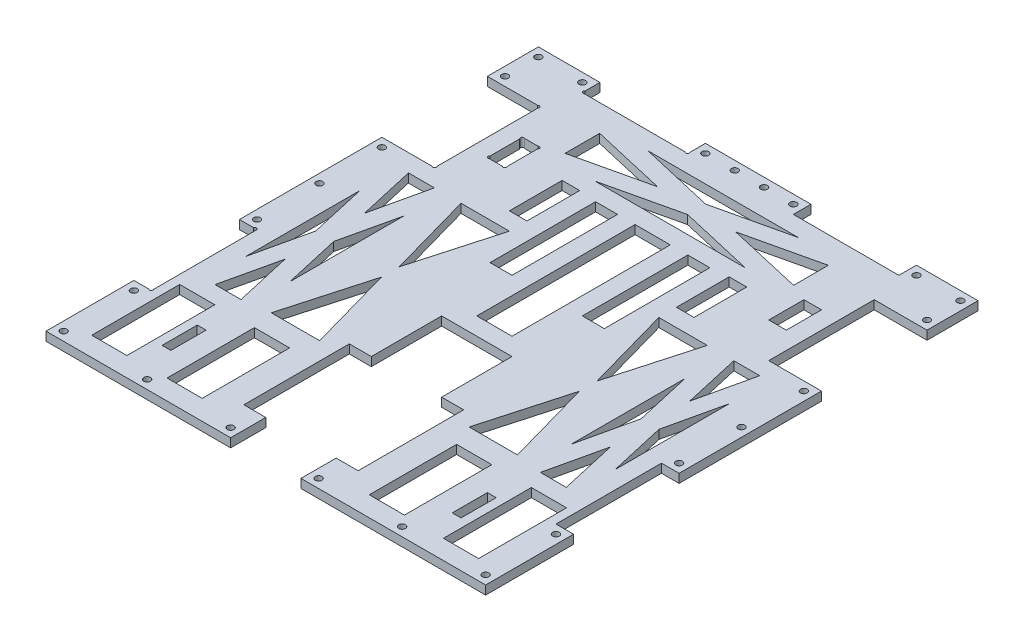
from build123d import *

# Parameters (mm, degrees)
SKETCH1_W           = 317.5
SKETCH1_H           = 355.6
BOSS_EXTRUDE1_DEPTH = 6.35
SKETCH2_W           = 50.8
SKETCH2_H           = 152.4
CUT_EXTRUDE1_DEPTH  = 239.442288615
SKETCH3_W           = 25.4
SKETCH3_H           = 76.2
SKETCH3_W_2         = 12.7
SKETCH3_H_2         = 25.4
CUT_EXTRUDE2_DEPTH  = 239.442288615
SKETCH4_W           = 12.7
SKETCH4_H           = 76.2
SKETCH4_W_2         = 76.2
SKETCH4_H_2         = 12.7
SKETCH4_W_3         = 15.875
CUT_EXTRUDE3_DEPTH  = 239.442288615
SKETCH5_W           = 25.4
SKETCH5_H           = 63.089423232
SKETCH5_H_2         = 114.3
SKETCH5_W_2         = 12.7
SKETCH5_H_3         = 38.1
SKETCH5_H_4         = 63.5
SKETCH5_W_3         = 6.35
SKETCH5_H_5         = 25.4
CUT_EXTRUDE4_DEPTH  = 239.442288615
SKETCH7_R           = 2.413
CUT_EXTRUDE6_DEPTH  = 239.442288615
SKETCH8_R           = 1.27
CUT_EXTRUDE7_DEPTH  = 239.442288615


with BuildPart() as part:
    # Sketch1 → Boss-Extrude1 (new body)
    with BuildSketch(Plane(origin=(0, 0, 0), x_dir=(1, 0, 0), z_dir=(0, 1, 0))):
        Rectangle(SKETCH1_W, SKETCH1_H)
    extrude(amount=BOSS_EXTRUDE1_DEPTH)

    # Sketch2 → Cut-Extrude1 (cut, through all)
    with BuildSketch(Plane(origin=(0, 6.35, 0), x_dir=(1, 0, 0), z_dir=(0, 1, 0))):
        with Locations((0, -101.6)):
            Rectangle(SKETCH2_W, SKETCH2_H)
    extrude(amount=-CUT_EXTRUDE1_DEPTH, mode=Mode.SUBTRACT)

    # Sketch3 → Cut-Extrude2 (cut, through all)
    with BuildSketch(Plane(origin=(0, 6.35, 0), x_dir=(1, 0, 0), z_dir=(0, 1, 0))):
        with Locations((133.35, 102.87)):
            Rectangle(SKETCH3_W, SKETCH3_H)
        with Locations((101.6, 102.87)):
            Rectangle(SKETCH3_W_2, SKETCH3_H_2)
        with Locations((-101.6, 102.87)):
            Rectangle(SKETCH3_W_2, SKETCH3_H_2)
        with Locations((-133.35, 102.87)):
            Rectangle(SKETCH3_W, SKETCH3_H)
    extrude(amount=-CUT_EXTRUDE2_DEPTH, mode=Mode.SUBTRACT)

    # Sketch4 → Cut-Extrude3 (cut, through all)
    with BuildSketch(Plane(origin=(0, 6.35, 0), x_dir=(1, 0, 0), z_dir=(0, 1, 0))):
        with Locations((-152.4, 102.87)):
            Rectangle(SKETCH4_W, SKETCH4_H)
        with Locations((-152.4, -76.2)):
            Rectangle(SKETCH4_W, SKETCH4_H)
        with Locations((152.4, 102.87)):
            Rectangle(SKETCH4_W, SKETCH4_H)
        with Locations((152.4, -76.2)):
            Rectangle(SKETCH4_W, SKETCH4_H)
        with Locations((76.2, 171.45)):
            Rectangle(SKETCH4_W_2, SKETCH4_H_2)
        with Locations((-76.2, 171.45)):
            Rectangle(SKETCH4_W_2, SKETCH4_H_2)
        with Locations((-33.3375, -114.3)):
            Rectangle(SKETCH4_W_3, SKETCH4_H)
        with Locations((33.3375, 63.5)):
            Rectangle(SKETCH4_W_3, SKETCH4_H)
        with Locations((-33.3375, 63.5)):
            Rectangle(SKETCH4_W_3, SKETCH4_H)
        with Locations((33.3375, -114.3)):
            Rectangle(SKETCH4_W_3, SKETCH4_H)
    extrude(amount=-CUT_EXTRUDE3_DEPTH, mode=Mode.SUBTRACT)

    # Sketch5 → Cut-Extrude4 (cut, through all)
    with BuildSketch(Plane(origin=(0, 6.35, 0), x_dir=(1, 0, 0), z_dir=(0, 1, 0))):
        with Locations((-73.025, -131.874711616)):
            Rectangle(SKETCH5_W, SKETCH5_H)
        Polygon((-117.475, -46.432505999), (-126.838066818, -87.63), (-108.111933182, -87.63), align=None)
        Polygon((-133.35, 23.417494001), (-133.35, -58.977494001), (-123.986933182, -17.78), align=None)
        Polygon((-101.6, 23.417494001), (-110.963066818, -17.78), (-101.6, -58.977494001), align=None)
        Polygon((-126.838066818, 52.07), (-117.475, 10.872505999), (-108.111933182, 52.07), align=None)
        Polygon((0, 126.833110246), (-54.310144398, 114.3), (54.310144398, 114.3), align=None)
        Polygon((-82.55, 145.883110246), (-82.55, 120.816889754), (-28.239855602, 133.35), align=None)
        Polygon((82.55, 145.883110246), (28.239855602, 133.35), (82.55, 120.816889754), align=None)
        Polygon((-54.310144398, 152.4), (0, 139.866889754), (54.310144398, 152.4), align=None)
        with Locations((0, 44.45)):
            Rectangle(SKETCH5_W, SKETCH5_H_2)
        with Locations((-60.325, 83.82)):
            Rectangle(SKETCH5_W_2, SKETCH5_H_3)
        with Locations((60.325, 83.82)):
            Rectangle(SKETCH5_W_2, SKETCH5_H_3)
        with Locations((-127, -132.08)):
            Rectangle(SKETCH5_W, SKETCH5_H_4)
        Polygon((-71.4375, -22.791352996), (-88.9, -84.952705992), (-53.975, -84.952705992), align=None)
        with Locations((-104.775, -132.08)):
            Rectangle(SKETCH5_W_3, SKETCH5_H_5)
        Polygon((-53.975, 52.07), (-88.9, 52.07), (-71.4375, -10.091352996), align=None)
    cut_extrude4 = extrude(amount=-CUT_EXTRUDE4_DEPTH, mode=Mode.SUBTRACT)

    # Mirror1: Cut-Extrude4 across plane
    add(cut_extrude4.mirror(Plane(origin=(0, 0, 0), x_dir=(0, 0, 1), z_dir=(1, 0, 0))), mode=Mode.SUBTRACT)

    # Sketch7 → Cut-Extrude6 (cut, through all)
    with BuildSketch(Plane(origin=(0, 6.35, 0), x_dir=(1, 0, 0), z_dir=(0, 1, 0))):
        with Locations((-152.4, -171.45)):
            Circle(SKETCH7_R)
        with Locations((-152.4, 171.45)):
            Circle(SKETCH7_R)
        with Locations((-120.65, 171.45)):
            Circle(SKETCH7_R)
        with Locations((-152.4, 147.32)):
            Circle(SKETCH7_R)
        with Locations((-31.75, 171.45)):
            Circle(SKETCH7_R)
        with Locations((-10.583333333, 171.45)):
            Circle(SKETCH7_R)
        with Locations((10.583333333, 171.45)):
            Circle(SKETCH7_R)
        with Locations((31.75, 171.45)):
            Circle(SKETCH7_R)
        with Locations((-31.75, -171.45)):
            Circle(SKETCH7_R)
        with Locations((-92.075, -171.45)):
            Circle(SKETCH7_R)
        with Locations((-152.4, -120.65)):
            Circle(SKETCH7_R)
        with Locations((-152.4, -31.75)):
            Circle(SKETCH7_R)
        with Locations((-152.4, 58.42)):
            Circle(SKETCH7_R)
        with Locations((-152.4, 13.335)):
            Circle(SKETCH7_R)
        with Locations((31.75, -171.45)):
            Circle(SKETCH7_R)
        with Locations((152.4, 13.335)):
            Circle(SKETCH7_R)
        with Locations((152.4, 58.42)):
            Circle(SKETCH7_R)
        with Locations((152.4, -31.75)):
            Circle(SKETCH7_R)
        with Locations((152.4, -120.65)):
            Circle(SKETCH7_R)
        with Locations((92.075, -171.45)):
            Circle(SKETCH7_R)
        with Locations((152.4, 147.32)):
            Circle(SKETCH7_R)
        with Locations((120.65, 171.45)):
            Circle(SKETCH7_R)
        with Locations((152.4, 171.45)):
            Circle(SKETCH7_R)
        with Locations((152.4, -171.45)):
            Circle(SKETCH7_R)
    extrude(amount=-CUT_EXTRUDE6_DEPTH, mode=Mode.SUBTRACT)

    # Sketch8 → Cut-Extrude7 (cut, through all)
    with BuildSketch(Plane(origin=(0, 6.35, 0), x_dir=(1, 0, 0), z_dir=(0, 1, 0))):
        with Locations((-39.09938383, 165.88366572)):
            Circle(SKETCH8_R)
        with Locations((-113.539841326, 166.117378391)):
            Circle(SKETCH8_R)
        with Locations((-121.560019166, 140.084130304)):
            Circle(SKETCH8_R)
        with Locations((-121.565556473, 65.650145639)):
            Circle(SKETCH8_R)
        with Locations((-147.253032713, -38.506954901)):
            Circle(SKETCH8_R)
        with Locations((-147.044413998, -113.510037468)):
            Circle(SKETCH8_R)
        with Locations((-107.194291917, 114.549311364)):
            Circle(SKETCH8_R)
        with Locations((-96.034081321, 114.570942203)):
            Circle(SKETCH8_R)
        with Locations((-107.184450657, 91.18332828)):
            Circle(SKETCH8_R)
        with Locations((-96.208355861, 91.003339093)):
            Circle(SKETCH8_R)
    extrude(amount=-CUT_EXTRUDE7_DEPTH, mode=Mode.SUBTRACT)


solid = part.part
